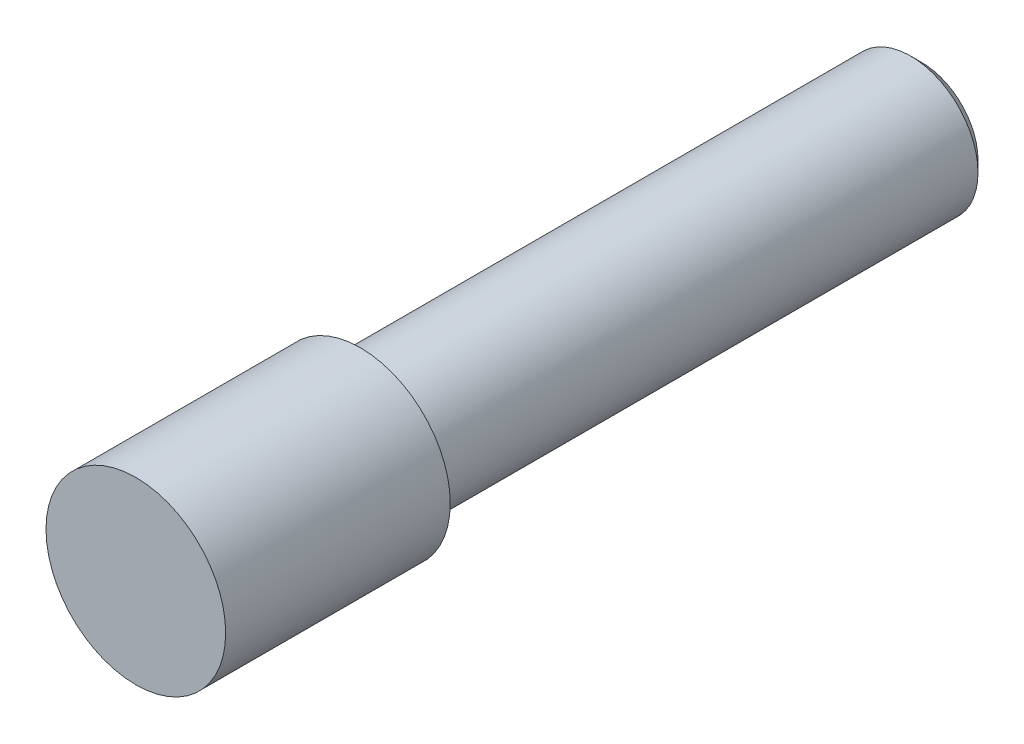
from build123d import *

# Parameters (mm, degrees)
ESQUISSE1_R        = 3
BOSS_EXTRU_1_DEPTH = 25
CHANFREIN1_SIZE    = 0.5
ESQUISSE2_R        = 4
BOSS_EXTRU_2_DEPTH = 10


with BuildPart() as part:
    # Esquisse1 → Boss.-Extru.1 (new body)
    with BuildSketch(Plane.XY):
        Circle(ESQUISSE1_R)
    extrude(amount=BOSS_EXTRU_1_DEPTH)

    # Chanfrein1
    chanfrein1_edges = [part.edges().sort_by_distance(p)[0] for p in [
        (-3, 0, 0),
    ]]
    chamfer(chanfrein1_edges, length=CHANFREIN1_SIZE)

    # Esquisse2 → Boss.-Extru.2 (add)
    with BuildSketch(Plane.XY.offset(25)):
        Circle(ESQUISSE2_R)
    extrude(amount=BOSS_EXTRU_2_DEPTH)


solid = part.part
